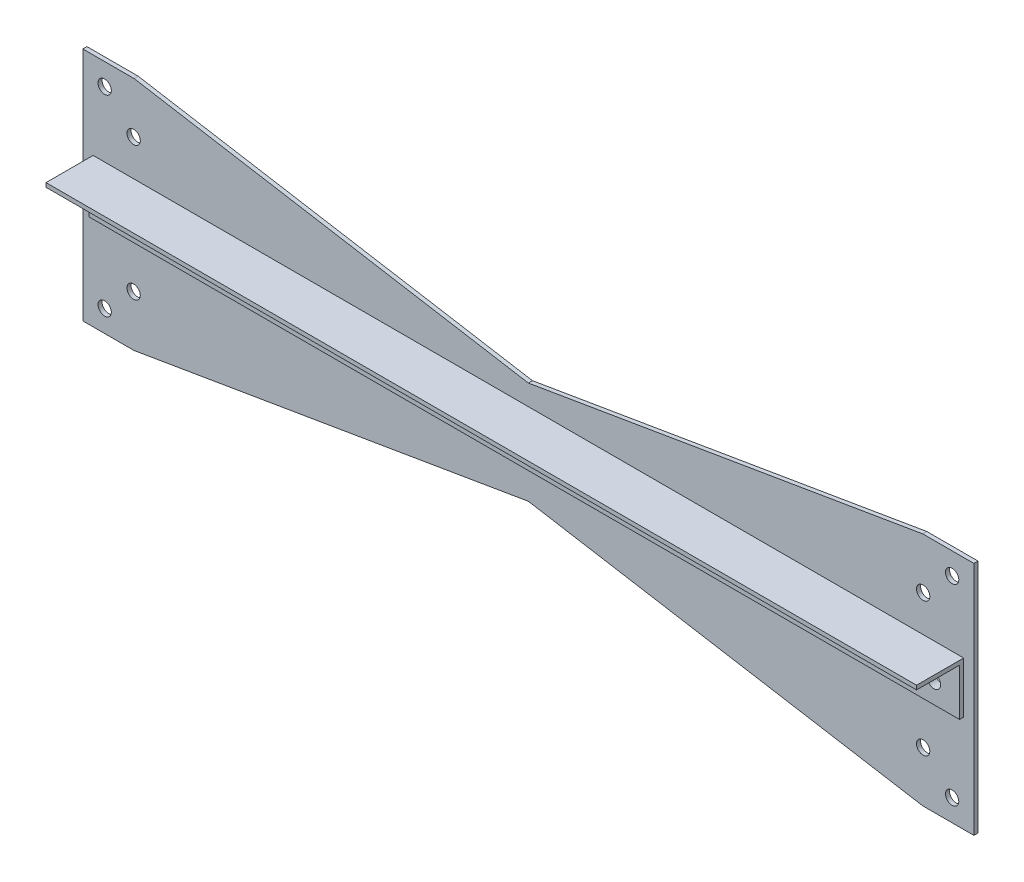
from build123d import *
from build123d.topology import SkipClean

# Parameters (mm, degrees)
EXTRUDE_2_DEPTH        = 8
SKETCH_5_W             = 850
SKETCH_5_H             = 100
EXTRUDE_3_DEPTH        = 8
SKETCH_6_W             = 850
SKETCH_6_H             = 8
EXTRUDE_4_DEPTH        = 84
SKETCH_7_R             = 13
CUT_EXTRUDE_1_DEPTH    = 905.579460302
SKETCH_9_R             = 13
CUT_EXTRUDE_3_DEPTH    = 904.800863022
PATTERN_LINEAR_2_COUNT = 6
PATTERN_LINEAR_2_PITCH = 160
MIRROR_7_DEPTH         = 16
MIRROR_7_2_OUTLINE_R   = 13
MIRROR_7_2_DEPTH       = 8
MIRROR_START           = 8
MIRROR_7_3_OUTLINE_R   = 13
MIRROR_7_3_DEPTH       = 8
MIRROR_START_2         = 16
MIRROR_7_4_OUTLINE_W   = 850
MIRROR_7_4_OUTLINE_H   = 8
MIRROR_7_4_DEPTH       = 84


# Read off the part's stored shape, not the designer's step: 镜向7
with BuildPart() as part:
    # 草图1 → 凸台-拉伸2 (new body)
    with BuildSketch(Plane.XY):
        Polygon((-870, 0), (-870, 230), (-770, 230), (0, 100), (0, 0), align=None)
    extrude_2 = extrude(amount=EXTRUDE_2_DEPTH)

    # 镜向2: 凸台-拉伸2 across plane
    add(extrude_2.mirror(Plane.ZX))

    # 草图5 → 凸台-拉伸3 (add)
    with BuildSketch(Plane.XY.offset(8)):
        with Locations((-425, 10)):
            Rectangle(SKETCH_5_W, SKETCH_5_H)
    extrude(amount=EXTRUDE_3_DEPTH)

    # 草图6 → 凸台-拉伸4 (add)
    with BuildSketch(Plane.XY.offset(16)):
        with Locations((-425, 56)):
            Rectangle(SKETCH_6_W, SKETCH_6_H)
    extrude(amount=EXTRUDE_4_DEPTH)

    # 草图7 → 切除-拉伸1 (cut, through all)
    with BuildSketch(Plane.XY.offset(8)):
        with Locations((-770.885465198, 130.885465198)):
            Circle(SKETCH_7_R)
        with Locations((-827.454007693, 187.454007693)):
            Circle(SKETCH_7_R)
    cut_extrude_1 = extrude(amount=-CUT_EXTRUDE_1_DEPTH, mode=Mode.SUBTRACT)

    # 镜向5: 切除-拉伸1 across plane
    add(cut_extrude_1.mirror(Plane.ZX), mode=Mode.SUBTRACT)

    # 草图9 → 切除-拉伸3 (cut, through all)
    with BuildSketch(Plane.XY.offset(16)):
        with Locations((-799.964208957, 0)):
            Circle(SKETCH_9_R)
    cut_extrude_3 = extrude(amount=-CUT_EXTRUDE_3_DEPTH, mode=Mode.SUBTRACT)

    # 阵列(线性)2: 切除-拉伸3 ×6
    with Locations(*[(i * PATTERN_LINEAR_2_PITCH, 0, 0) for i in range(1, PATTERN_LINEAR_2_COUNT)]):
        add(cut_extrude_3, mode=Mode.SUBTRACT)

    # 镜向7 outline → 镜向7 (cut)
    with BuildSketch(Plane.XY):
        with BuildLine():
            ThreePointArc((0, -12.999950731), (-12.964208957, 0), (0, 12.999950731))
            ThreePointArc((0, 12.999950731), (-13.035791043, 0), (0, -12.999950731))
        make_face()
    extrude(amount=MIRROR_7_DEPTH, mode=Mode.SUBTRACT)

    # Mirror 7 2 outline → Mirror 7 2 (add)
    with BuildSketch(Plane.XY):
        with BuildLine():
            Line((870, -230), (870, 230))
            Line((870, 230), (770, 230))
            Line((770, 230), (0, 100))
            Line((0, 100), (0, 12.999950731))
            ThreePointArc((0, 12.999950731), (12.964208957, 0), (0, -12.999950731))
            Line((0, -12.999950731), (0, -100))
            Line((0, -100), (770, -230))
            Line((770, -230), (870, -230))
        make_face()
        with Locations((827.454007693, -187.454007693)):
            Circle(MIRROR_7_2_OUTLINE_R, mode=Mode.SUBTRACT)
        with Locations((770.885465198, -130.885465198)):
            Circle(MIRROR_7_2_OUTLINE_R, mode=Mode.SUBTRACT)
        with Locations((770.885465198, 130.885465198)):
            Circle(MIRROR_7_2_OUTLINE_R, mode=Mode.SUBTRACT)
        with Locations((827.454007693, 187.454007693)):
            Circle(MIRROR_7_2_OUTLINE_R, mode=Mode.SUBTRACT)
        with Locations((639.964208957, 0)):
            Circle(MIRROR_7_2_OUTLINE_R, mode=Mode.SUBTRACT)
        with Locations((799.964208957, 0)):
            Circle(MIRROR_7_2_OUTLINE_R, mode=Mode.SUBTRACT)
        with Locations((159.964208957, 0)):
            Circle(MIRROR_7_2_OUTLINE_R, mode=Mode.SUBTRACT)
        with Locations((319.964208957, 0)):
            Circle(MIRROR_7_2_OUTLINE_R, mode=Mode.SUBTRACT)
        with Locations((479.964208957, 0)):
            Circle(MIRROR_7_2_OUTLINE_R, mode=Mode.SUBTRACT)
    extrude(amount=MIRROR_7_2_DEPTH)

    # Mirror 7 3 outline → Mirror 7 3 (add)
    with SkipClean():  # the faces are left unmerged after this step: merging them gives an invalid solid
        with BuildSketch(Plane.XY.offset(MIRROR_START)):
            with BuildLine():
                Line((850, 60), (0, 60))
                Line((0, 60), (0, 12.999950731))
                ThreePointArc((0, 12.999950731), (12.964208957, 0), (0, -12.999950731))
                Line((0, -12.999950731), (0, -40))
                Line((0, -40), (850, -40))
                Line((850, -40), (850, 60))
            make_face()
            with Locations((799.964208957, 0)):
                Circle(MIRROR_7_3_OUTLINE_R, mode=Mode.SUBTRACT)
            with Locations((159.964208957, 0)):
                Circle(MIRROR_7_3_OUTLINE_R, mode=Mode.SUBTRACT)
            with Locations((319.964208957, 0)):
                Circle(MIRROR_7_3_OUTLINE_R, mode=Mode.SUBTRACT)
            with Locations((479.964208957, 0)):
                Circle(MIRROR_7_3_OUTLINE_R, mode=Mode.SUBTRACT)
            with Locations((639.964208957, 0)):
                Circle(MIRROR_7_3_OUTLINE_R, mode=Mode.SUBTRACT)
        extrude(amount=MIRROR_7_3_DEPTH)

    # Mirror 7 4 outline → Mirror 7 4 (add)
    with SkipClean():  # the faces are left unmerged after this step: merging them gives an invalid solid
        with BuildSketch(Plane.XY.offset(MIRROR_START_2)):
            with Locations((425, 56)):
                Rectangle(MIRROR_7_4_OUTLINE_W, MIRROR_7_4_OUTLINE_H)
        extrude(amount=MIRROR_7_4_DEPTH)


solid = part.part
